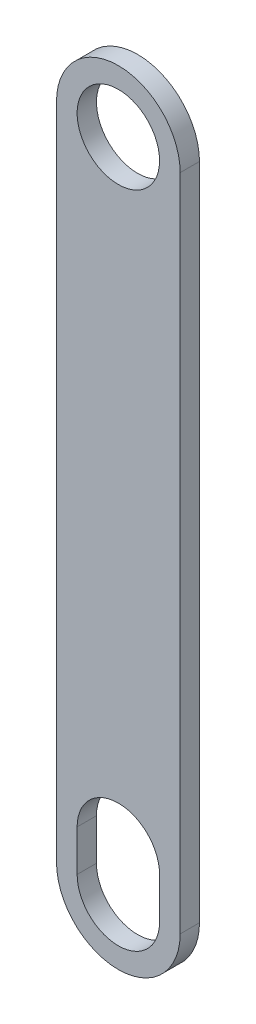
from build123d import *

# Parameters (mm, degrees)
SKETCH1_R           = 8.466666667
BOSS_EXTRUDE1_DEPTH = 3.96875
SCALE1_SCALE        = 0.75
CUT_EXTRUDE1_DEPTH  = 129.439187722


with BuildPart() as part:
    # Sketch1 → Boss-Extrude1 (new body)
    with BuildSketch(Plane.XY):
        with BuildLine():
            Line((-12.7, 0), (-12.7, 135.4582))
            ThreePointArc((-12.7, 135.4582), (0, 148.1582), (12.7, 135.4582))
            Line((12.7, 135.4582), (12.7, 0))
            ThreePointArc((12.7, 0), (0, -12.7), (-12.7, 0))
        make_face()
        Circle(SKETCH1_R, mode=Mode.SUBTRACT)
        with Locations((0, 135.4582)):
            Circle(SKETCH1_R, mode=Mode.SUBTRACT)
    extrude(amount=BOSS_EXTRUDE1_DEPTH)


with BuildPart() as part_1:
    # Scale1: scaled about (0, 67.7291, 1.984375)
    add(part.part.scale(SCALE1_SCALE).moved(Location((0, 16.932275, 0.49609375))))

    # Sketch2 → Cut-Extrude1 (cut, through all)
    with BuildSketch(Plane.XY.offset(3.47265625)):
        with BuildLine():
            Line((-6.35, 23.275925), (-6.35, 16.932275))
            Line((-6.35, 16.932275), (6.35, 16.932275))
            Line((6.35, 16.932275), (6.35, 23.275925))
            ThreePointArc((6.35, 23.275925), (0, 29.625925), (-6.35, 23.275925))
        make_face()
    extrude(amount=-CUT_EXTRUDE1_DEPTH, mode=Mode.SUBTRACT)


solid = part_1.part
